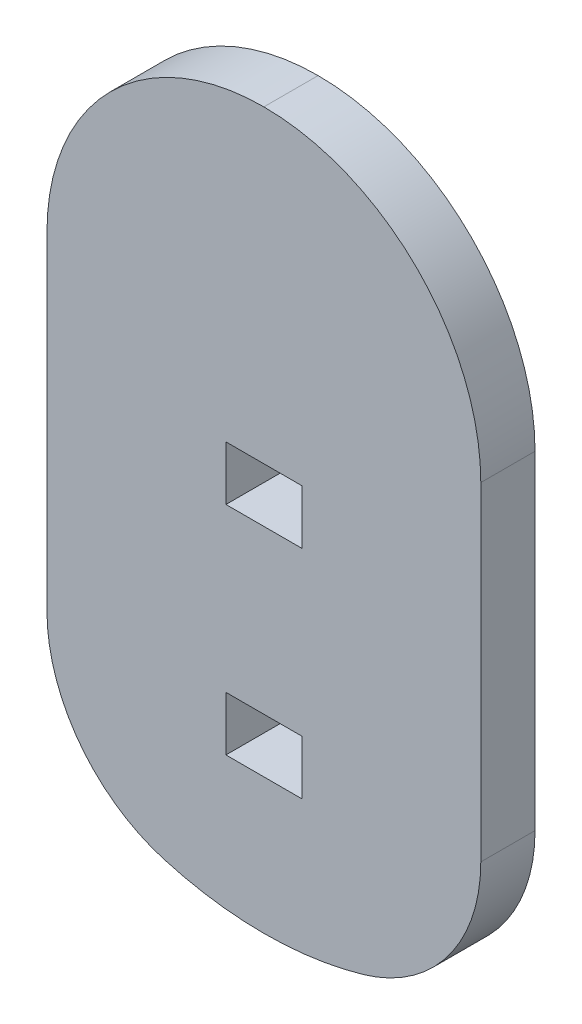
from build123d import *

# Parameters (mm, degrees)
SKETCH1_R           = 33
BOSS_EXTRUDE1_DEPTH = 5
CUT_EXTRUDE3_START  = -10
CUT_EXTRUDE3_DEPTH  = 10
FILLET2_R           = 20
FILLET3_R           = 15
SKETCH11_W          = 7
SKETCH11_H          = 5
CUT_EXTRUDE4_DEPTH  = 10


with BuildPart() as part:
    # Sketch1 → Boss-Extrude1 (new body)
    with BuildSketch(Plane.XY):
        Circle(SKETCH1_R)
    extrude(amount=BOSS_EXTRUDE1_DEPTH)

    # Sketch10 → Cut-Extrude3 (cut)
    with BuildSketch(Plane.XY.offset(5).offset(CUT_EXTRUDE3_START)):
        with BuildLine():
            Line((-20, 26.248809497), (-20, -26.248809497))
            ThreePointArc((-20, -26.248809497), (-33, 0), (-20, 26.248809497))
        make_face()
        with BuildLine():
            Line((20, 26.248809497), (20, -26.248809497))
            ThreePointArc((20, -26.248809497), (33, 0), (20, 26.248809497))
        make_face()
    extrude(amount=CUT_EXTRUDE3_DEPTH, mode=Mode.SUBTRACT)

    # Fillet2
    fillet2_edges = [part.edges().sort_by_distance(p)[0] for p in [
        (-20, 26.248809497, 2.5),
        (20, 26.248809497, 2.5),
    ]]
    fillet(fillet2_edges, radius=FILLET2_R - 0.0001)  # a hair under: the kernel refuses the full size

    # Fillet3
    fillet3_edges = [part.edges().sort_by_distance(p)[0] for p in [
        (-20, -26.248809497, 2.5),
        (20, -26.248809497, 2.5),
    ]]
    fillet(fillet3_edges, radius=FILLET3_R)

    # Sketch11 → Cut-Extrude4 (cut)
    with BuildSketch(Plane.XY.offset(5)):
        with Locations((0, 2)):
            Rectangle(SKETCH11_W, SKETCH11_H)
        with Locations((0, -18)):
            Rectangle(SKETCH11_W, SKETCH11_H)
    extrude(amount=-CUT_EXTRUDE4_DEPTH, mode=Mode.SUBTRACT)


solid = part.part
